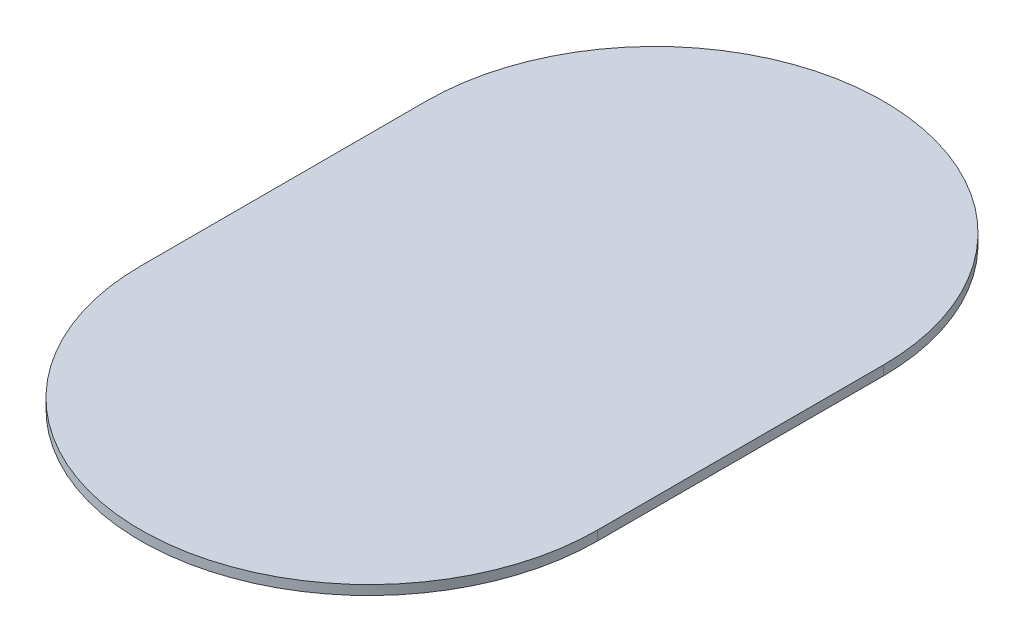
from build123d import *

# Parameters (mm, degrees)
BOSS_EXTRUDE1_DEPTH = 2.5


with BuildPart() as part:
    # Sketch1 → Boss-Extrude1 (new body)
    with BuildSketch(Plane(origin=(0, 0, 0), x_dir=(1, 0, 0), z_dir=(0, 1, 0))):
        with BuildLine():
            Line((-60, -37.5), (-60, 37.5))
            ThreePointArc((-60, 37.5), (0, 97.5), (60, 37.5))
            Line((60, 37.5), (60, -37.5))
            ThreePointArc((60, -37.5), (0, -97.5), (-60, -37.5))
        make_face()
    extrude(amount=BOSS_EXTRUDE1_DEPTH)


solid = part.part
